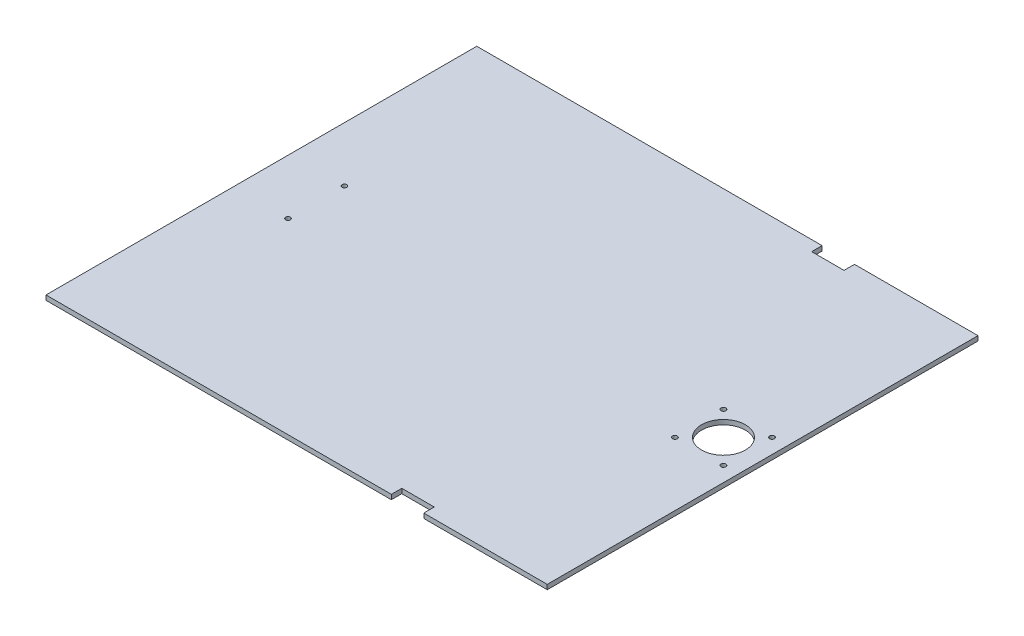
from build123d import *

# Parameters (mm, degrees)
SKETCH1_W                      = 320
SKETCH1_H                      = 275
BOSS_EXTRUDE1_DEPTH            = 3
TALADRO_DE_MARGEN_PARA_M2_51_D = 3.1
SKETCH6_R                      = 1.5
CUT_EXTRUDE1_DEPTH             = 211.986373968
SKETCH7_R                      = 14
CUT_EXTRUDE2_DEPTH             = 10
SKETCH8_W                      = 20.691757384
SKETCH8_H                      = 6.672372381
CUT_EXTRUDE3_DEPTH             = 10


with BuildPart() as part:
    # Sketch1 → Boss-Extrude1 (new body)
    with BuildSketch(Plane(origin=(0, 0, 0), x_dir=(1, 0, 0), z_dir=(0, 1, 0))):
        Rectangle(SKETCH1_W, SKETCH1_H)
    extrude(amount=BOSS_EXTRUDE1_DEPTH)

    # Taladro de margen para M2.51 (through all)
    with Locations(Plane(origin=(0, 3, 0), x_dir=(1, 0, 0), z_dir=(0, 1, 0))):
        with Locations((150.5, 15.5), (150.5, -15.5), (119.5, -15.5), (119.5, 15.5)):
            Hole(TALADRO_DE_MARGEN_PARA_M2_51_D / 2)

    # Sketch6 → Cut-Extrude1 (cut, through all)
    with BuildSketch(Plane(origin=(0, 3, 0), x_dir=(1, 0, 0), z_dir=(0, 1, 0))):
        with Locations((-125, -18)):
            Circle(SKETCH6_R)
        with Locations((-125, 18)):
            Circle(SKETCH6_R)
    extrude(amount=-CUT_EXTRUDE1_DEPTH, mode=Mode.SUBTRACT)

    # Sketch7 → Cut-Extrude2 (cut)
    with BuildSketch(Plane(origin=(0, 3, 0), x_dir=(1, 0, 0), z_dir=(0, 1, 0))):
        with Locations((135, -1e-09)):
            Circle(SKETCH7_R)
    extrude(amount=-CUT_EXTRUDE2_DEPTH, mode=Mode.SUBTRACT)

    # Sketch8 → Cut-Extrude3 (cut)
    with BuildSketch(Plane(origin=(0, 3, 0), x_dir=(1, 0, 0), z_dir=(0, 1, 0))):
        with Locations((70.81926153, -134.163813809)):
            Rectangle(SKETCH8_W, SKETCH8_H)
        with Locations((70.81926153, 134.163813809)):
            Rectangle(SKETCH8_W, SKETCH8_H)
    extrude(amount=-CUT_EXTRUDE3_DEPTH, mode=Mode.SUBTRACT)


solid = part.part
